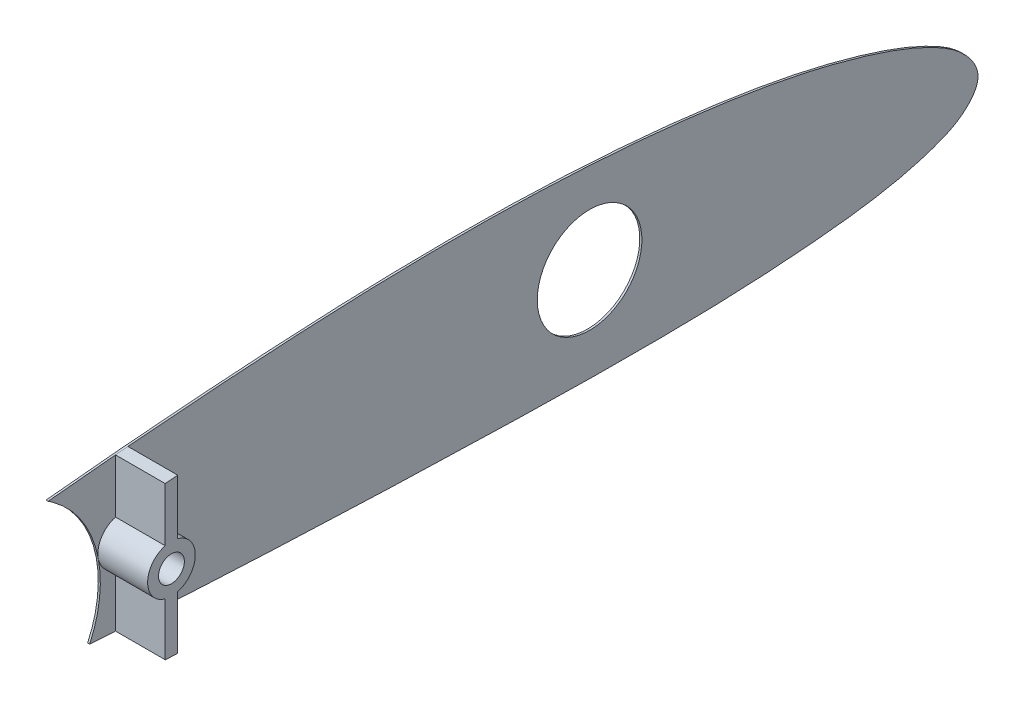
from build123d import *

# Parameters (mm, degrees)
SKETCH15_R           = 2.5
BOSS_EXTRUDE10_DEPTH = 10
SKETCH17_R           = 10.1
SKETCH17_R_2         = 2.5
BOSS_EXTRUDE11_DEPTH = 0.4


with BuildPart() as part:
    # Sketch15 → Boss-Extrude10 (new body)
    with BuildSketch(Plane.ZY.offset(-1117)):
        with BuildLine():
            Line((164.119375135, 20.589784832), (164.119375135, 9.981195826))
            ThreePointArc((164.119375135, 9.981195826), (160.719375135, 5.540475164), (164.119375135, 1.099754501))
            Line((164.119375135, 1.099754501), (164.119375135, -9.231754782))
            add(Edge.make_bspline(
                [(166.519375135, -9.091208566), (165.719360385, -9.137798042), (164.919360897, -9.184656559), (164.119375135, -9.231754782)],
                knots=[0.777434237, 0.777434237, 0.777434237, 0.777434237, 0.781363712, 0.781363712, 0.781363712, 0.781363712], degree=3))
            Line((166.519375135, -9.091208566), (166.519375135, 1.099754501))
            ThreePointArc((166.519375135, 1.099754501), (169.919375135, 5.540475164), (166.519375135, 9.981195826))
            Line((166.519375135, 9.981195826), (166.519375135, 20.378194743))
            add(Edge.make_bspline(
                [(164.119375135, 20.589784832), (164.919288647, 20.518297025), (165.719289674, 20.447769954), (166.519375135, 20.378194743)],
                knots=[0.220716551, 0.220716551, 0.220716551, 0.220716551, 0.22465439, 0.22465439, 0.22465439, 0.22465439], degree=3))
        make_face()
        with Locations((165.319375135, 5.540475164)):
            Circle(SKETCH15_R, mode=Mode.SUBTRACT)
    extrude(amount=-BOSS_EXTRUDE10_DEPTH)

    # Sketch17 → Boss-Extrude11 (add)
    with BuildSketch(Plane.ZY.offset(-1117)):
        with BuildLine():
            ThreePointArc((178.526126507, 18.427048811), (170.149334223, 6.071124871), (171.510243557, -8.794521134))
            add(Edge.make_bspline(
                [(179.541699574, 19.127259062), (169.708345912, 20.138854057), (149.879925079, 21.867658214), (120.026341518, 23.635097209), (94.990664557, 23.935808407), (74.981855474, 23.107465721), (59.962978235, 21.893704318), (44.925139834, 19.97163417), (32.409919206, 17.604753461), (22.432539712, 14.926973956), (14.868276975, 12.492476274), (8.45946997, 9.655920822), (2.931290987, 6.216911108), (-1.889468689, 0.269631354), (3.118016179, -4.957920198), (8.542791775, -7.342160266), (14.923403388, -9.153243486), (22.462762474, -10.451795047), (32.480073396, -11.559964158), (44.984109362, -12.412907572), (59.998233621, -12.754877712), (75.001642297, -12.707223024), (95.003495515, -12.26571363), (120.008146035, -11.471242967), (147.177810667, -10.219143906), (164.341376764, -9.224404268), (171.510243557, -8.794521134)],
                knots=[0.210464417, 0.210464417, 0.210464417, 0.210464417, 0.258935447, 0.308046851, 0.357082998, 0.381621902, 0.40622148, 0.430945072, 0.455928851, 0.468620095, 0.481536682, 0.495009685, 0.502394397, 0.51458913, 0.524739406, 0.531581267, 0.544365664, 0.556821315, 0.56916216, 0.593739443, 0.618265018, 0.642782356, 0.667304548, 0.716364225, 0.765450655, 0.800665859, 0.800665859, 0.800665859, 0.800665859], degree=3))
            ThreePointArc((179.541699574, 19.127259062), (179.029209678, 18.784182215), (178.526126507, 18.427048811))
        make_face()
        with Locations((74.982510175, 5.540475164)):
            Circle(SKETCH17_R, mode=Mode.SUBTRACT)
        with Locations((165.319375135, 5.540475164)):
            Circle(SKETCH17_R_2, mode=Mode.SUBTRACT)
    extrude(amount=-BOSS_EXTRUDE11_DEPTH)


solid = part.part
